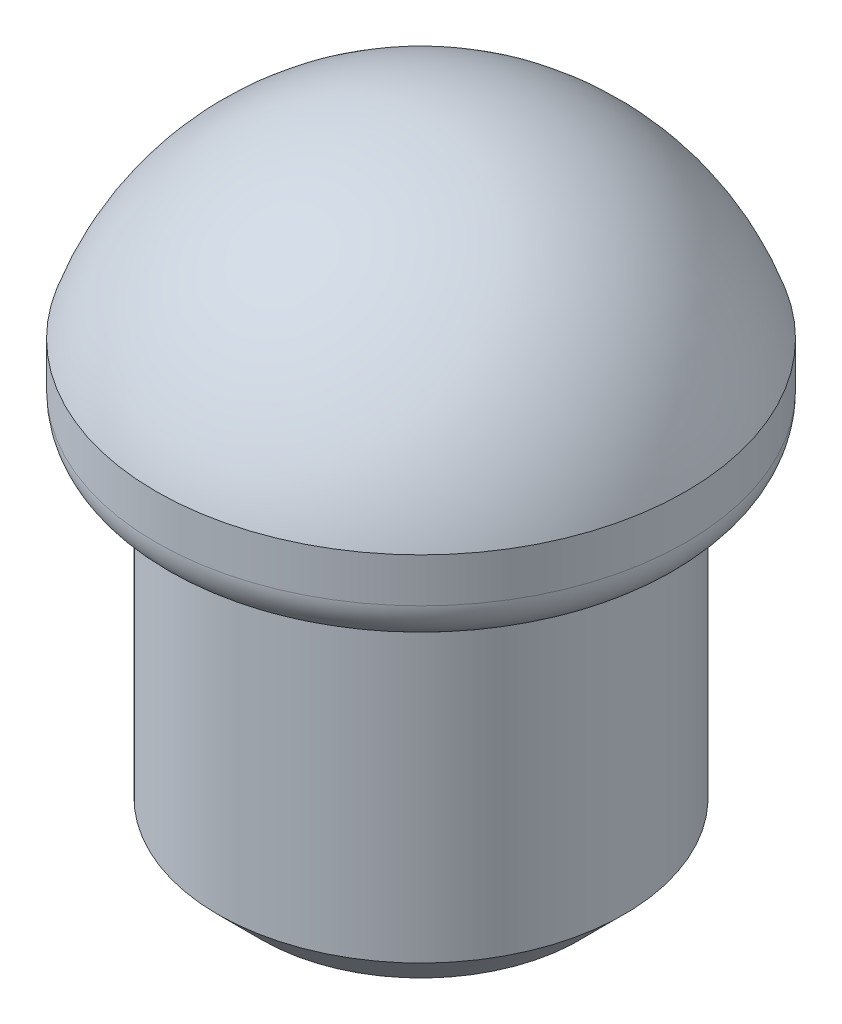
from build123d import *

# Parameters (mm, degrees)
SKETCH1_R           = 2.3
BOSS_EXTRUDE1_DEPTH = 4
FILLET1_R           = 0.5
CHAMFER1_SIZE       = 0.5


with BuildPart() as part:
    # Sketch1 → Boss-Extrude1 (new body)
    with BuildSketch(Plane(origin=(0, 0, 0), x_dir=(1, 0, 0), z_dir=(0, 1, 0))):
        Circle(SKETCH1_R)
    extrude(amount=BOSS_EXTRUDE1_DEPTH)

    # Sketch2 → Revolve1 (revolve)
    with BuildSketch(Plane.XY):
        with BuildLine():
            Line((-3, 5), (-3, 4))
            Line((-3, 4), (0, 4))
            Line((0, 4), (0, 7.16227766))
            ThreePointArc((0, 7.16227766), (-1.849016271, 6.565373039), (-3, 5))
        make_face()
    revolve(axis=Axis((0, -2.040480146, 0), (0, 1, 0)))

    # Fillet1
    fillet1_edges = [part.edges().sort_by_distance(p)[0] for p in [
        (3, 4, 0),
    ]]
    fillet(fillet1_edges, radius=FILLET1_R)

    # Chamfer1
    chamfer1_edges = [part.edges().sort_by_distance(p)[0] for p in [
        (-2.3, 0, 0),
    ]]
    chamfer(chamfer1_edges, length=CHAMFER1_SIZE)


solid = part.part
